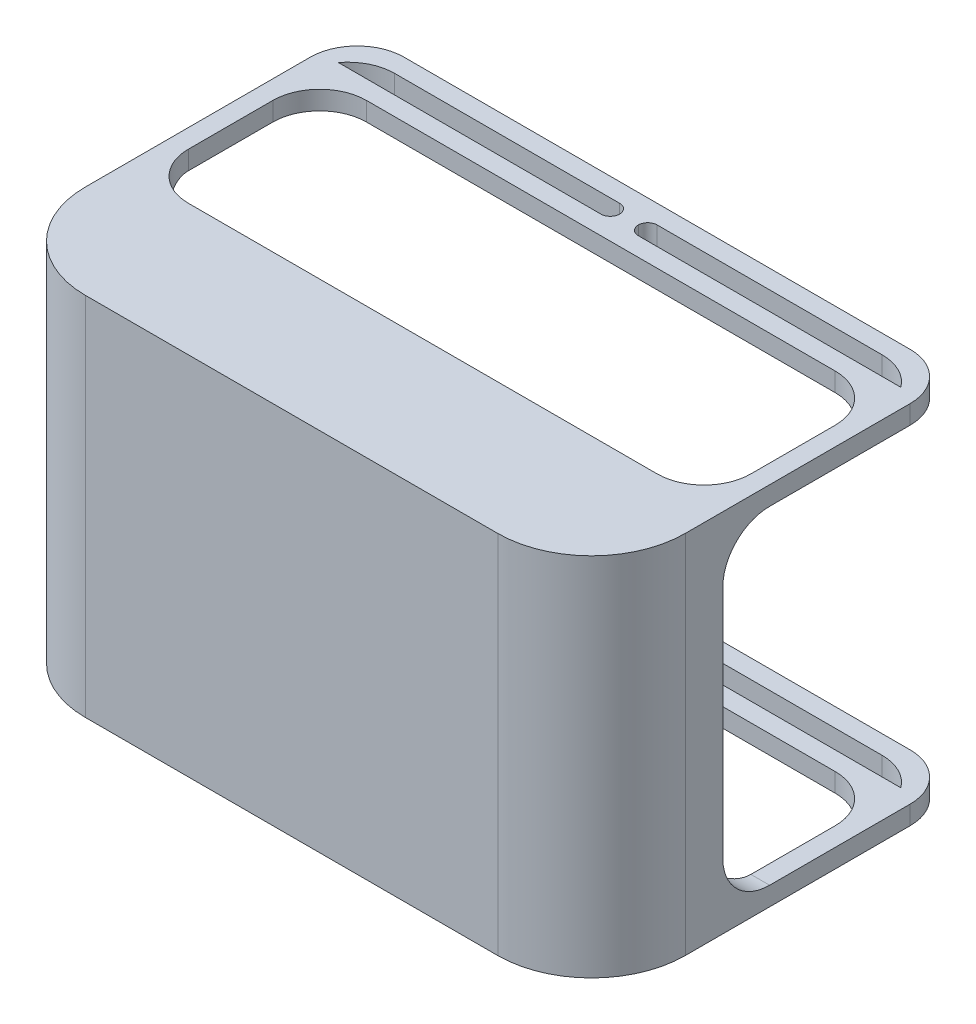
from build123d import *

# Parameters (mm, degrees)
BOSS_EXTRUDE1_DEPTH      = 195
BOSS_EXTRUDE1_DEPTH_BACK = 195
BOSS_EXTRUDE1_START      = -20000
SKETCH1_W                = 640
SKETCH1_H                = 390
SKETCH2_W                = 300
SKETCH2_H                = 350
CUT_EXTRUDE1_DEPTH       = 20207.079530676
SKETCH3_W                = 290
SKETCH3_H                = 20
SKETCH3_W_2              = 600
SKETCH3_H_2              = 190
CUT_EXTRUDE2_DEPTH       = 20202.300081925
FILLET1_R                = 50
FILLET2_R                = 10
FILLET4_R                = 100


# Some blends are built 0.0001 mm under size
with BuildPart() as part:
    # Sketch1 → Boss-Extrude1 (new, two sides: drawn at the far end of the back side and taken through both)
    with BuildSketch(Plane.XY.offset(BOSS_EXTRUDE1_START - BOSS_EXTRUDE1_DEPTH_BACK)):
        Rectangle(SKETCH1_W, SKETCH1_H)
    extrude(amount=BOSS_EXTRUDE1_DEPTH + BOSS_EXTRUDE1_DEPTH_BACK)

    # Sketch2 → Cut-Extrude1 (cut, through all)
    with BuildSketch(Plane(origin=(320, 0, 0), x_dir=(0, 0, -1), z_dir=(1, 0, 0))):
        with Locations((20095, 0)):
            Rectangle(SKETCH2_W, SKETCH2_H)
    extrude(amount=-CUT_EXTRUDE1_DEPTH, mode=Mode.SUBTRACT)

    # Sketch3 → Cut-Extrude2 (cut, through all)
    with BuildSketch(Plane.XZ.offset(195)):
        with Locations((-155, -20165)):
            Rectangle(SKETCH3_W, SKETCH3_H)
        with Locations((155, -20165)):
            Rectangle(SKETCH3_W, SKETCH3_H)
        with Locations((0, -20040)):
            Rectangle(SKETCH3_W_2, SKETCH3_H_2)
    extrude(amount=-CUT_EXTRUDE2_DEPTH, mode=Mode.SUBTRACT)

    # Fillet1
    # the kernel refuses this fillet: 50 mm, written as the material it adds along each edge
    with BuildSketch(Plane(origin=(300, -195, -20135), x_dir=(-1, 0, 0), z_dir=(0, 1, 0)), Plane(origin=(-300, -195, -20135), x_dir=(0, 0, 1), z_dir=(0, 1, 0)), Plane(origin=(300, 175, -19945), x_dir=(0, 0, -1), z_dir=(0, 1, 0)), Plane(origin=(-300, -175, -19945), x_dir=(0, 1, 0), z_dir=(-1, 0, 0)), Plane(origin=(320, -175, -19945), x_dir=(0, 1, 0), z_dir=(-1, 0, 0)), Plane(origin=(-300, -195, -19945), x_dir=(1, 0, 0), z_dir=(0, 1, 0))) as fillet1_piece_1:
        with BuildLine():
            CenterArc((FILLET1_R, FILLET1_R), FILLET1_R, 180, 90)
            Line((0, FILLET1_R), (0, 0))
            Line((0, 0), (FILLET1_R, 0))
        make_face()
    extrude(amount=20)
    with BuildSketch(Plane(origin=(300, 175, -20135), x_dir=(0, 0, 1), z_dir=(0, 1, 0)), Plane(origin=(-300, 175, -20135), x_dir=(1, 0, 0), z_dir=(0, 1, 0)), Plane(origin=(300, -195, -19945), x_dir=(-1, 0, 0), z_dir=(0, 1, 0)), Plane(origin=(-300, 175, -19945), x_dir=(0, -1, 0), z_dir=(-1, 0, 0)), Plane(origin=(320, 175, -19945), x_dir=(0, -1, 0), z_dir=(-1, 0, 0)), Plane(origin=(-300, 175, -19945), x_dir=(0, 0, -1), z_dir=(0, 1, 0))) as fillet1_piece_2:
        with BuildLine():
            CenterArc((FILLET1_R, -FILLET1_R), FILLET1_R, 90, 90)
            Line((0, -FILLET1_R), (0, 0))
            Line((0, 0), (FILLET1_R, 0))
        make_face()
    extrude(amount=20)
    with BuildSketch(Plane(origin=(-300, -195, -20175), x_dir=(0, 0, 1), z_dir=(0, 1, 0))) as fillet1_piece_3:
        with BuildLine():
            CenterArc((50, 40), FILLET1_R, 180, 53.130102354)
            Line((0, 40), (0, 0))
            Line((0, 0), (20, 0))
        make_face()
    extrude(amount=20)
    with BuildSketch(Plane(origin=(-300, 175, -20175), x_dir=(1, 0, 0), z_dir=(0, 1, 0))) as fillet1_piece_4:
        with BuildLine():
            CenterArc((40, -50), FILLET1_R, 90, 53.130102354)
            Line((0, -20), (0, 0))
            Line((0, 0), (40, 0))
        make_face()
    extrude(amount=20)
    with BuildSketch(Plane(origin=(300, -195, -20175), x_dir=(-1, 0, 0), z_dir=(0, 1, 0))) as fillet1_piece_5:
        with BuildLine():
            CenterArc((40, 50), FILLET1_R, 216.869897646, 53.130102354)
            Line((0, 20), (0, 0))
            Line((0, 0), (40, 0))
        make_face()
    extrude(amount=20)
    with BuildSketch(Plane(origin=(300, 175, -20175), x_dir=(0, 0, 1), z_dir=(0, 1, 0))) as fillet1_piece_6:
        with BuildLine():
            CenterArc((50, -40), FILLET1_R, 126.869897646, 53.130102354)
            Line((0, -40), (0, 0))
            Line((0, 0), (20, 0))
        make_face()
    extrude(amount=20)
    with BuildSketch(Plane(origin=(320, -175, -19945), x_dir=(0, 1, 0), z_dir=(-1, 0, 0))) as fillet1_piece_7a_section:
        with BuildLine():
            CenterArc((FILLET1_R, FILLET1_R), FILLET1_R, 180, 90)
            Line((0, FILLET1_R), (0, 0))
            Line((0, 0), (FILLET1_R, 0))
        make_face()
    fillet1_piece_7a = extrude(amount=145, mode=Mode.PRIVATE)
    fillet1_piece_7a = split(fillet1_piece_7a, bisect_by=Plane(origin=(300, -175, -19945), z_dir=(-1, 0, 0)), keep=Keep.TOP, mode=Mode.PRIVATE)
    with BuildSketch(Plane(origin=(300, -195, -19945), x_dir=(-1, 0, 0), z_dir=(0, 1, 0))) as fillet1_piece_7b_section:
        with BuildLine():
            CenterArc((FILLET1_R, -FILLET1_R), FILLET1_R, 90, 90)
            Line((0, -FILLET1_R), (0, 0))
            Line((0, 0), (FILLET1_R, 0))
        make_face()
    fillet1_piece_7b = extrude(amount=145, mode=Mode.PRIVATE)
    fillet1_piece_7b = split(fillet1_piece_7b, bisect_by=Plane(origin=(300, -175, -19945), z_dir=(0, 1, 0)), keep=Keep.TOP, mode=Mode.PRIVATE)
    fillet1_piece_7 = fillet1_piece_7a & fillet1_piece_7b
    add(fillet1_piece_7)
    with BuildSketch(Plane(origin=(300, 50, -19945), x_dir=(0, 0, -1), z_dir=(0, 1, 0))) as fillet1_piece_8a_section:
        with BuildLine():
            CenterArc((FILLET1_R, FILLET1_R), FILLET1_R, 180, 90)
            Line((0, FILLET1_R), (0, 0))
            Line((0, 0), (FILLET1_R, 0))
        make_face()
    fillet1_piece_8a = extrude(amount=145, mode=Mode.PRIVATE)
    fillet1_piece_8a = split(fillet1_piece_8a, bisect_by=Plane(origin=(300, 175, -19945), z_dir=(0, -1, 0)), keep=Keep.TOP, mode=Mode.PRIVATE)
    with BuildSketch(Plane(origin=(320, 175, -19945), x_dir=(0, -1, 0), z_dir=(-1, 0, 0))) as fillet1_piece_8b_section:
        with BuildLine():
            CenterArc((FILLET1_R, -FILLET1_R), FILLET1_R, 90, 90)
            Line((0, -FILLET1_R), (0, 0))
            Line((0, 0), (FILLET1_R, 0))
        make_face()
    fillet1_piece_8b = extrude(amount=145, mode=Mode.PRIVATE)
    fillet1_piece_8b = split(fillet1_piece_8b, bisect_by=Plane(origin=(300, 175, -19945), z_dir=(-1, 0, 0)), keep=Keep.TOP, mode=Mode.PRIVATE)
    fillet1_piece_8 = fillet1_piece_8a & fillet1_piece_8b
    add(fillet1_piece_8)
    with BuildSketch(Plane(origin=(-300, 50, -19945), x_dir=(0, 0, -1), z_dir=(0, 1, 0))) as fillet1_piece_9a_section:
        with BuildLine():
            CenterArc((FILLET1_R, -FILLET1_R), FILLET1_R, 90, 90)
            Line((0, -FILLET1_R), (0, 0))
            Line((0, 0), (FILLET1_R, 0))
        make_face()
    fillet1_piece_9a = extrude(amount=145, mode=Mode.PRIVATE)
    fillet1_piece_9a = split(fillet1_piece_9a, bisect_by=Plane(origin=(-300, 175, -19945), z_dir=(0, -1, 0)), keep=Keep.TOP, mode=Mode.PRIVATE)
    with BuildSketch(Plane(origin=(-175, 175, -19945), x_dir=(0, -1, 0), z_dir=(-1, 0, 0))) as fillet1_piece_9b_section:
        with BuildLine():
            CenterArc((FILLET1_R, -FILLET1_R), FILLET1_R, 90, 90)
            Line((0, -FILLET1_R), (0, 0))
            Line((0, 0), (FILLET1_R, 0))
        make_face()
    fillet1_piece_9b = extrude(amount=145, mode=Mode.PRIVATE)
    fillet1_piece_9b = split(fillet1_piece_9b, bisect_by=Plane(origin=(-300, 175, -19945), z_dir=(1, 0, 0)), keep=Keep.TOP, mode=Mode.PRIVATE)
    fillet1_piece_9 = fillet1_piece_9a & fillet1_piece_9b
    add(fillet1_piece_9)
    with BuildSketch(Plane(origin=(-300, -195, -19945), x_dir=(1, 0, 0), z_dir=(0, 1, 0))) as fillet1_piece_10a_section:
        with BuildLine():
            CenterArc((FILLET1_R, FILLET1_R), FILLET1_R, 180, 90)
            Line((0, FILLET1_R), (0, 0))
            Line((0, 0), (FILLET1_R, 0))
        make_face()
    fillet1_piece_10a = extrude(amount=145, mode=Mode.PRIVATE)
    fillet1_piece_10a = split(fillet1_piece_10a, bisect_by=Plane(origin=(-300, -175, -19945), z_dir=(0, 1, 0)), keep=Keep.TOP, mode=Mode.PRIVATE)
    with BuildSketch(Plane(origin=(-175, -175, -19945), x_dir=(0, 1, 0), z_dir=(-1, 0, 0))) as fillet1_piece_10b_section:
        with BuildLine():
            CenterArc((FILLET1_R, FILLET1_R), FILLET1_R, 180, 90)
            Line((0, FILLET1_R), (0, 0))
            Line((0, 0), (FILLET1_R, 0))
        make_face()
    fillet1_piece_10b = extrude(amount=145, mode=Mode.PRIVATE)
    fillet1_piece_10b = split(fillet1_piece_10b, bisect_by=Plane(origin=(-300, -175, -19945), z_dir=(1, 0, 0)), keep=Keep.TOP, mode=Mode.PRIVATE)
    fillet1_piece_10 = fillet1_piece_10a & fillet1_piece_10b
    add(fillet1_piece_10)
    # the kernel refuses this fillet: 50 mm, written as the material it takes off along each edge
    with BuildSketch(Plane(origin=(320, -50, -20195), x_dir=(-1, 0, 0), z_dir=(0, -1, 0)), Plane(origin=(-320, -320, -20195), x_dir=(1, 0, 0), z_dir=(0, 1, 0)), Plane(origin=(320, 320, -20195), x_dir=(-1, 0, 0), z_dir=(0, -1, 0))) as fillet1_2_piece_1:
        with BuildLine():
            CenterArc((FILLET1_R, -FILLET1_R), FILLET1_R, 90, 90)
            Line((0, -FILLET1_R), (0, 0))
            Line((0, 0), (FILLET1_R, 0))
        make_face()
    extrude(amount=270, mode=Mode.SUBTRACT)
    with BuildSketch(Plane(origin=(-320, 50, -20195), x_dir=(0, 0, 1), z_dir=(0, 1, 0))) as fillet1_2_piece_2:
        with BuildLine():
            CenterArc((FILLET1_R, FILLET1_R), FILLET1_R, 180, 90)
            Line((0, FILLET1_R), (0, 0))
            Line((0, 0), (FILLET1_R, 0))
        make_face()
    extrude(amount=270, mode=Mode.SUBTRACT)

    # Fillet2
    fillet2_edges = [part.edges().sort_by_distance(p)[0] for p in [
        (-10, -185, -20175),
        (-10, 185, -20175),
        (10, -185, -20175),
        (10, 185, -20175),
        (10, 185, -20155),
        (10, -185, -20155),
        (-10, 185, -20155),
        (-10, -185, -20155),
    ]]
    fillet(fillet2_edges, radius=FILLET2_R - 0.0001)  # a hair under: the kernel refuses the full size

    # Fillet4
    fillet4_edges = [part.edges().sort_by_distance(p)[0] for p in [
        (-320, 0, -19805),
        (320, 0, -19805),
    ]]
    fillet(fillet4_edges, radius=FILLET4_R)


solid = part.part
